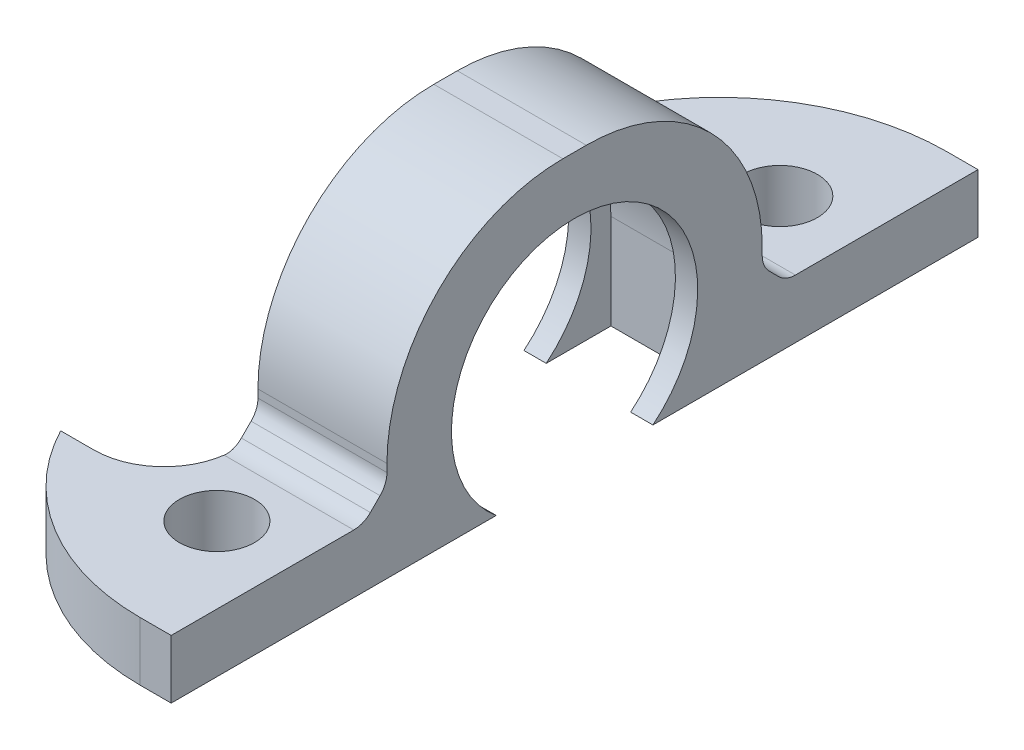
from build123d import *
from build123d.topology import SkipClean

# Parameters (mm, degrees)
SKETCH1_W               = 15
SKETCH1_H               = 35
BOSS_EXTRUDE1_DEPTH     = 2.5
CUT_EXTRUDE2_DEPTH      = 20.20286437
CUT_EXTRUDE2_DEPTH_BACK = 20.20286437
SKETCH3_W               = 4.75
SKETCH3_H               = 35
CUT_EXTRUDE3_DEPTH      = 20.20286437
FILLET1_R               = 10
CUT_EXTRUDE5_DEPTH      = 20.20286437
SKETCH7_R               = 1.6
CUT_EXTRUDE6_DEPTH      = 19.798797059
BOSS_EXTRUDE2_DEPTH     = 5.499997748
CUT_EXTRUDE7_START      = -0.95
CUT_EXTRUDE7_DEPTH      = 3.6
SKETCH11_R              = 5.25
CUT_EXTRUDE8_DEPTH      = 24.068697681
CHAMFER1_SIZE           = 1
FILLET2_R               = 1


with BuildPart() as part:
    # Sketch1 → Boss-Extrude1 (new body)
    with BuildSketch(Plane(origin=(0, 0, 0), x_dir=(1, 0, 0), z_dir=(0, 1, 0))):
        Rectangle(SKETCH1_W, SKETCH1_H)
    extrude(amount=BOSS_EXTRUDE1_DEPTH)

    # Sketch3 → Cut-Extrude2 (cut, two sides: drawn at the far end of the back side and taken through both)
    with BuildSketch(Plane.XZ.offset(-CUT_EXTRUDE2_DEPTH_BACK)):
        with Locations((5.125, 0)):
            Rectangle(SKETCH3_W, SKETCH3_H)
    extrude(amount=CUT_EXTRUDE2_DEPTH + CUT_EXTRUDE2_DEPTH_BACK, mode=Mode.SUBTRACT)

    # Sketch5 → Cut-Extrude3 (cut, through all)
    with BuildSketch(Plane(origin=(0, 2.5, 0), x_dir=(1, 0, 0), z_dir=(0, 1, 0))):
        with BuildLine():
            Line((-5.749997748, -12), (-10.249997748, -12))
            ThreePointArc((-10.249997748, -12), (-12.371318091, -11.121320344), (-13.249997748, -9))
            Line((-13.249997748, -9), (-13.249997748, 9))
            ThreePointArc((-13.249997748, 9), (-12.371318091, 11.121320344), (-10.249997748, 12))
            Line((-10.249997748, 12), (-5.749997748, 12))
            ThreePointArc((-5.749997748, 12), (-3.628677404, 11.121320344), (-2.749997748, 9))
            Line((-2.749997748, 9), (-2.749997748, -9))
            ThreePointArc((-2.749997748, -9), (-3.628677404, -11.121320344), (-5.749997748, -12))
        make_face()
    extrude(amount=-CUT_EXTRUDE3_DEPTH, mode=Mode.SUBTRACT)

    # Fillet1
    # the kernel refuses this fillet: 10 mm, written as the material it takes off along each edge
    with BuildSketch(Plane(origin=(-7.5, -22.325713874, 17.5), x_dir=(1, 0, 0), z_dir=(0, 1, 0))) as fillet1_piece_1:
        with BuildLine():
            CenterArc((8.93028555, 10), FILLET1_R, 206.74368395, 63.25631605)
            Line((0, 5.5), (-0.178605711, 5.41))
            ThreePointArc((-0.178605711, 5.41), (-0.2, 2.75), (-0.2, 0))
            Line((-0.2, 0), (0, -0.2))
            Line((0, -0.2), (8.93028555, -0.2))
            Line((8.93028555, -0.2), (8.93028555, 0))
        make_face()
    extrude(amount=47.151427749, mode=Mode.SUBTRACT)
    with BuildSketch(Plane(origin=(-7.5, -22.325713874, -17.5), x_dir=(1, 0, 0), z_dir=(0, 1, 0))) as fillet1_piece_2:
        with BuildLine():
            CenterArc((8.93028555, -10), FILLET1_R, 90, 63.25631605)
            Line((0, -5.5), (-0.178605711, -5.41))
            ThreePointArc((-0.178605711, -5.41), (-0.2, -2.75), (-0.2, 0))
            Line((-0.2, 0), (0, 0.2))
            Line((0, 0.2), (8.93028555, 0.2))
            Line((8.93028555, 0.2), (8.93028555, 0))
        make_face()
    extrude(amount=47.151427749, mode=Mode.SUBTRACT)

    # Sketch6 → Cut-Extrude5 (cut, through all)
    with BuildSketch(Plane(origin=(0, 2.5, 0), x_dir=(1, 0, 0), z_dir=(0, 1, 0))):
        with BuildLine():
            Line((1.43028555, 17.2), (2.75, 17.2))
            Line((2.75, 17.2), (2.75, 17.5))
            Line((2.75, 17.5), (1.43028555, 17.5))
            ThreePointArc((1.43028555, 17.5), (-3.813758691, 16.014693183), (-7.5, 12))
            Line((-7.5, 12), (-7.162734874, 12))
            ThreePointArc((-7.162734874, 12), (-3.591666262, 15.798795093), (1.43028555, 17.2))
        make_face()
        with BuildLine():
            Line((2.75, -17.5), (2.75, -17.2))
            Line((2.75, -17.2), (1.43028555, -17.2))
            ThreePointArc((1.43028555, -17.2), (-3.591666262, -15.798795093), (-7.162734874, -12))
            Line((-7.162734874, -12), (-7.5, -12))
            ThreePointArc((-7.5, -12), (-3.813758691, -16.014693183), (1.43028555, -17.5))
            Line((1.43028555, -17.5), (2.75, -17.5))
        make_face()
    extrude(amount=-CUT_EXTRUDE5_DEPTH, mode=Mode.SUBTRACT)

    # Sketch7 → Cut-Extrude6 (cut, through all)
    with BuildSketch(Plane(origin=(0, 2.5, 0), x_dir=(1, 0, 0), z_dir=(0, 1, 0))):
        with Locations(Location((-0.5, 12, 0), (0, 0, 270))):
            Circle(SKETCH7_R)
        with Locations(Location((-0.5, -12, 0), (0, 0, 270))):
            Circle(SKETCH7_R)
    extrude(amount=-CUT_EXTRUDE6_DEPTH, mode=Mode.SUBTRACT)

    # Sketch9 → Boss-Extrude2 (add)
    with BuildSketch(Plane(origin=(2.75, 0, 0), x_dir=(0, 0, -1), z_dir=(1, 0, 0))):
        with BuildLine():
            Line((-8, 2.5), (-5.015974482, 2.5))
            ThreePointArc((-5.015974482, 2.5), (-0.783783762, 9.241163936), (5.25, 4.05))
            ThreePointArc((5.25, 4.05), (5.191163936, 3.266216238), (5.015974482, 2.5))
            Line((5.015974482, 2.5), (8, 2.5))
            Line((8, 2.5), (8, 4.25))
            ThreePointArc((8, 4.25), (5.803300859, 9.553300859), (0.5, 11.75))
            Line((0.5, 11.75), (-0.5, 11.75))
            ThreePointArc((-0.5, 11.75), (-5.803300859, 9.553300859), (-8, 4.25))
            Line((-8, 4.25), (-8, 2.5))
        make_face()
    extrude(amount=-BOSS_EXTRUDE2_DEPTH)

    # Sketch10 → Cut-Extrude7 (cut)
    with BuildSketch(Plane(origin=(2.75, 0, 0), x_dir=(0, 0, -1), z_dir=(1, 0, 0)).offset(CUT_EXTRUDE7_START)):
        with BuildLine():
            ThreePointArc((6.1, 4.05), (0, 10.15), (-6.1, 4.05))
            ThreePointArc((-6.1, 4.05), (-5.70242473, 1.883816212), (-4.561523868, 0))
            Line((-4.561523868, 0), (-3.340658618, 0))
            ThreePointArc((-3.340658618, 0), (-4.361287561, 1.127386305), (-5.015974482, 2.5))
            ThreePointArc((-5.015974482, 2.5), (-0.783783762, 9.241163936), (5.25, 4.05))
            ThreePointArc((5.25, 4.05), (5.191163936, 3.266216238), (5.015974482, 2.5))
            ThreePointArc((5.015974482, 2.5), (4.361287561, 1.127386305), (3.340658618, 0))
            Line((3.340658618, 0), (4.561523868, 0))
            ThreePointArc((4.561523868, 0), (5.70242473, 1.883816212), (6.1, 4.05))
        make_face()
        with BuildLine():
            ThreePointArc((-4.561523868, 0), (-5.70242473, 1.883816212), (-6.1, 4.05))
            Line((-6.1, 4.05), (-6.1, 0))
            Line((-6.1, 0), (-4.561523868, 0))
        make_face()
        with BuildLine():
            Line((6.1, 0), (6.1, 4.05))
            ThreePointArc((6.1, 4.05), (5.70242473, 1.883816212), (4.561523868, 0))
            Line((4.561523868, 0), (6.1, 0))
        make_face()
    extrude(amount=-CUT_EXTRUDE7_DEPTH, mode=Mode.SUBTRACT)

    # Sketch11 → Cut-Extrude8 (cut, through all)
    with SkipClean():  # the faces are left unmerged after this step: merging them gives an invalid solid
        with BuildSketch(Plane(origin=(2.75, 0, 0), x_dir=(0, 0, -1), z_dir=(1, 0, 0))):
            with Locations((0, 4.05)):
                Circle(SKETCH11_R)
        extrude(amount=-CUT_EXTRUDE8_DEPTH, mode=Mode.SUBTRACT)

    # Chamfer1
    chamfer1_edges = [part.edges().sort_by_distance(p)[0] for p in [
        (1.126e-06, 2.5, 8),
        (1.126e-06, 2.5, -8),
    ]]
    chamfer(chamfer1_edges, length=CHAMFER1_SIZE)

    # Fillet2
    fillet2_edges = [part.edges().sort_by_distance(p)[0] for p in [
        (1.126e-06, 3.5, 8),
        (1.126e-06, 2.5, 9),
        (1.126e-06, 2.5, -9),
        (1.126e-06, 3.5, -8),
    ]]
    fillet(fillet2_edges, radius=FILLET2_R)


solid = part.part
